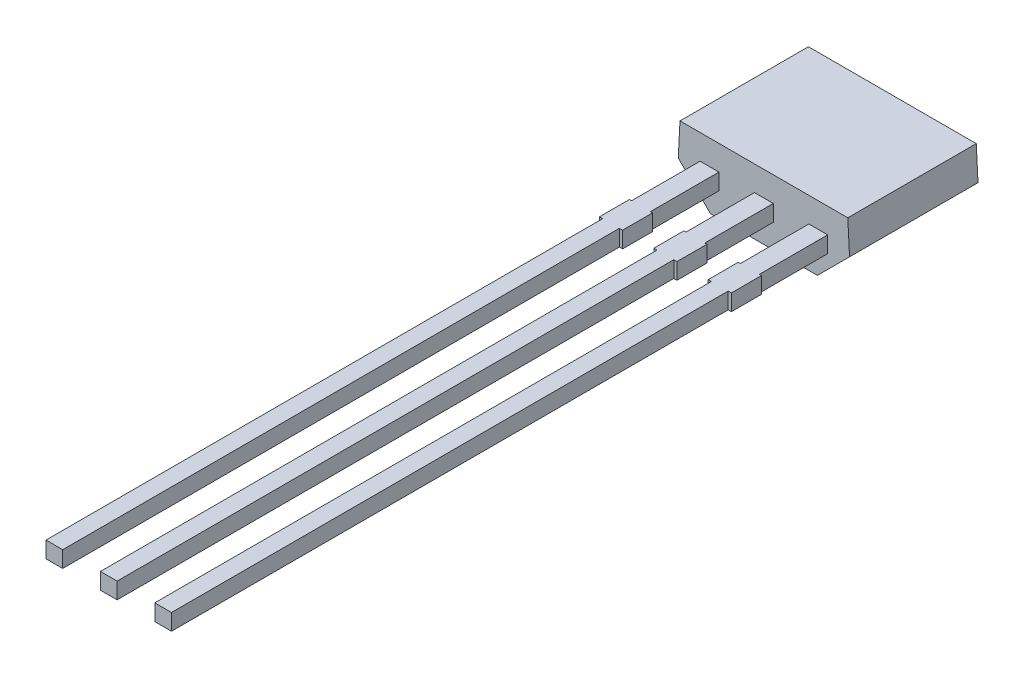
from build123d import *
from OCP.BRepFilletAPI import BRepFilletAPI_MakeChamfer

# Parameters (mm, degrees)
SKETCH1_W           = 4
SKETCH1_H           = 3
BOSS_EXTRUDE1_DEPTH = 0.77
SKETCH3_W           = 4
SKETCH3_H           = 3
BOSS_EXTRUDE2_DEPTH = 0.75
CHAMFER1_SIZE       = 0.75
CHAMFER2_SIZE       = 0.77
CHAMFER2_SIZE_2     = 0.04035399
SKETCH4_W           = 0.44
SKETCH4_H           = 0.38
BOSS_EXTRUDE3_DEPTH = 1.6
SKETCH5_W           = 0.54
SKETCH5_H           = 0.38
BOSS_EXTRUDE4_DEPTH = 0.7
SKETCH6_W           = 0.39
SKETCH6_H           = 0.38
BOSS_EXTRUDE5_DEPTH = 13
LPATTERN1_COUNT     = 3
LPATTERN1_PITCH     = 1.27


with BuildPart() as part:
    # Sketch1 → Boss-Extrude1 (new body)
    with BuildSketch(Plane(origin=(0, 0, 0), x_dir=(1, 0, 0), z_dir=(0, 1, 0))):
        with Locations((0, 1.5)):
            Rectangle(SKETCH1_W, SKETCH1_H)
    extrude(amount=BOSS_EXTRUDE1_DEPTH)

    # Sketch3 → Boss-Extrude2 (add)
    with BuildSketch(Plane.XZ):
        with Locations((0, -1.5)):
            Rectangle(SKETCH3_W, SKETCH3_H)
    extrude(amount=BOSS_EXTRUDE2_DEPTH)

    # Chamfer1
    chamfer1_edges = [part.edges().sort_by_distance(p)[0] for p in [
        (-2, -0.75, -1.5),
        (2, -0.75, -1.5),
    ]]
    chamfer(chamfer1_edges, length=CHAMFER1_SIZE)

    # Chamfer2
    chamfer2_edges_1 = [part.edges().sort_by_distance(p)[0] for p in [
        (-2, 0.77, -1.5),
    ]]
    chamfer2_side_1 = [part.faces().sort_by_distance(p)[0] for p in [
        (-2, 0.76919292, -1.5),
    ]]
    chamfer2_edges_2 = [part.edges().sort_by_distance(p)[0] for p in [
        (2, 0.77, -1.5),
    ]]
    chamfer2_side_2 = [part.faces().sort_by_distance(p)[0] for p in [
        (1.99919292, 0.77, -1.5),
    ]]
    chamfer2 = BRepFilletAPI_MakeChamfer(part.part.solid().wrapped)
    for e in chamfer2_edges_1:
        chamfer2.Add(CHAMFER2_SIZE - 0.0001, CHAMFER2_SIZE_2 - 0.0001, e.wrapped, chamfer2_side_1[0].wrapped)
    for e in chamfer2_edges_2:
        chamfer2.Add(CHAMFER2_SIZE_2 - 0.0001, CHAMFER2_SIZE - 0.0001, e.wrapped, chamfer2_side_2[0].wrapped)
    add(Compound.cast(chamfer2.Shape()), mode=Mode.REPLACE)  # a hair under: the kernel refuses the full size

    # Sketch4 → Boss-Extrude3 (add)
    with BuildSketch(Plane.XY):
        with Locations((-1.27, 0)):
            Rectangle(SKETCH4_W, SKETCH4_H)
    boss_extrude3 = extrude(amount=BOSS_EXTRUDE3_DEPTH)

    # Sketch5 → Boss-Extrude4 (add)
    with BuildSketch(Plane.XY.offset(1.6)):
        with Locations((-1.27, 0)):
            Rectangle(SKETCH5_W, SKETCH5_H)
    boss_extrude4 = extrude(amount=BOSS_EXTRUDE4_DEPTH)

    # Sketch6 → Boss-Extrude5 (add)
    with BuildSketch(Plane.XY.offset(2.3)):
        with Locations((-1.27, 0)):
            Rectangle(SKETCH6_W, SKETCH6_H)
    boss_extrude5 = extrude(amount=BOSS_EXTRUDE5_DEPTH)

    # LPattern1: Boss-Extrude3, Boss-Extrude4, Boss-Extrude5 ×3
    with Locations(*[(i * LPATTERN1_PITCH, 0, 0) for i in range(1, LPATTERN1_COUNT)]):
        add(boss_extrude3)
        add(boss_extrude4)
        add(boss_extrude5)


solid = part.part
